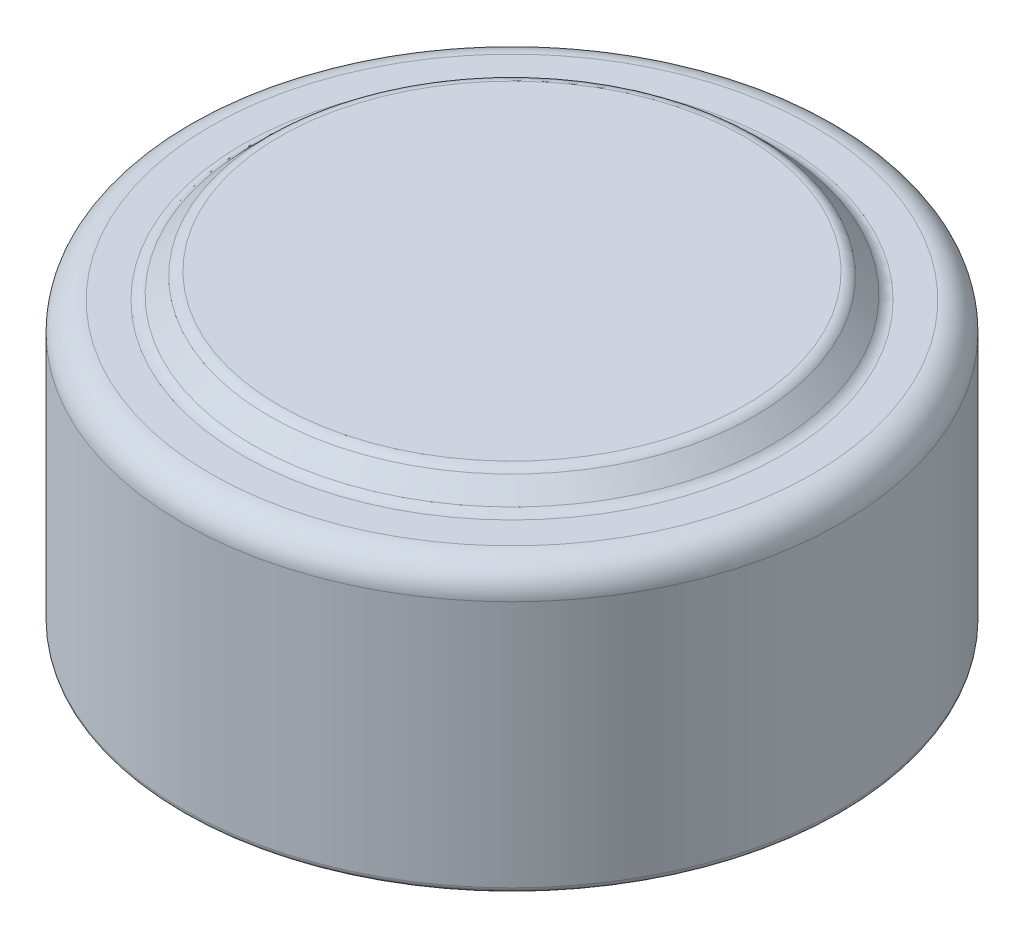
from build123d import *


with BuildPart() as part:
    # Sketch1 → Revolve1 (revolve)
    with BuildSketch(Plane.XY):
        with BuildLine():
            Line((0, 0), (-5.7, 0))
            ThreePointArc((-5.7, 0), (-5.770710678, 0.029289322), (-5.8, 0.1))
            Line((-5.8, 0.1), (-5.8, 4.46))
            ThreePointArc((-5.8, 4.46), (-5.653553391, 4.813553391), (-5.3, 4.96))
            Line((-5.3, 4.96), (-4.743553391, 4.96))
            ThreePointArc((-4.743553391, 4.96), (-4.647882533, 4.979030117), (-4.566776695, 5.033223305))
            Line((-4.566776695, 5.033223305), (-4.273223305, 5.326776695))
            ThreePointArc((-4.273223305, 5.326776695), (-4.192117467, 5.380969883), (-4.096446609, 5.4))
            Line((-4.096446609, 5.4), (0, 5.4))
            Line((0, 5.4), (0, 0))
        make_face()
    revolve(axis=Axis((0, 5.4, 0), (0, -1, 0)))


solid = part.part
